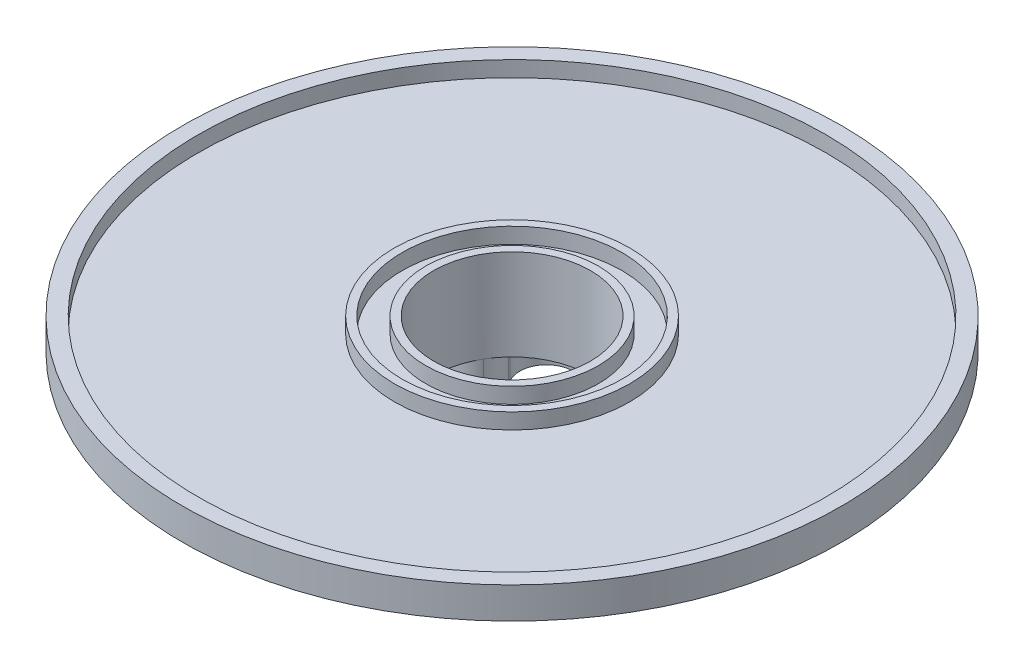
from build123d import *
from build123d.topology import SkipClean

# Parameters (mm, degrees)
CUT_EXTRUDE1_DEPTH  = 11
FILLET1_R           = 8
SKETCH3_R           = 3
CUT_EXTRUDE2_DEPTH  = 3
SKETCH4_R           = 5
CUT_EXTRUDE3_DEPTH  = 4.5
SKETCH5_R           = 25
CUT_EXTRUDE4_DEPTH  = 152.297719745
SKETCH6_R           = 37.5
SKETCH6_R_2         = 35
SKETCH6_R_3         = 27.5
SKETCH6_R_4         = 25
BOSS_EXTRUDE1_DEPTH = 5
CUT_EXTRUDE5_START  = -30
CUT_EXTRUDE5_DEPTH  = 30


# Read off the part's stored shape, not the designer's step: Cut-Extrude5
with BuildPart() as part:
    # Sketch1 → Revolve1 (revolve)
    with BuildSketch(Plane.XY, mode=Mode.PRIVATE) as revolve1_sk:
        Polygon((0, 0), (-50, 0), (-50, 30), (-105, 30), (-105, 40), (-100, 40), (-100, 35), (0, 35), align=None)
    revolve(revolve1_sk.sketch.rotate(Axis((0, 0, 0), (0, 1, 0)), 270), axis=Axis((0, 0, 0), (0, 1, 0)))

    # Sketch2 → Cut-Extrude1 (cut)
    with BuildSketch(Plane.XZ):
        with BuildLine():
            Line((-22.361215932, 21.730762114), (-19.116533878, 16.110807941))
            ThreePointArc((-19.116533878, 16.110807941), (-21.650635095, 12.5), (-23.510635891, 8.5))
            Line((-23.510635891, 8.5), (-30, 8.5))
            ThreePointArc((-30, 8.5), (-38.5, 0), (-30, -8.5))
            Line((-30, -8.5), (-23.510635891, -8.5))
            ThreePointArc((-23.510635891, -8.5), (-21.650635095, -12.5), (-19.116533878, -16.110807941))
            Line((-19.116533878, -16.110807941), (-22.361215932, -21.730762114))
            ThreePointArc((-22.361215932, -21.730762114), (-19.25, -33.341978046), (-7.638784068, -30.230762114))
            Line((-7.638784068, -30.230762114), (-4.394102013, -24.610807941))
            ThreePointArc((-4.394102013, -24.610807941), (0, -25), (4.394102013, -24.610807941))
            Line((4.394102013, -24.610807941), (7.638784068, -30.230762114))
            ThreePointArc((7.638784068, -30.230762114), (19.25, -33.341978046), (22.361215932, -21.730762114))
            Line((22.361215932, -21.730762114), (19.116533878, -16.110807941))
            ThreePointArc((19.116533878, -16.110807941), (21.650635095, -12.5), (23.510635891, -8.5))
            Line((23.510635891, -8.5), (30, -8.5))
            ThreePointArc((30, -8.5), (38.5, 0), (30, 8.5))
            Line((30, 8.5), (23.510635891, 8.5))
            ThreePointArc((23.510635891, 8.5), (21.650635095, 12.5), (19.116533878, 16.110807941))
            Line((19.116533878, 16.110807941), (22.361215932, 21.730762114))
            ThreePointArc((22.361215932, 21.730762114), (19.25, 33.341978046), (7.638784068, 30.230762114))
            Line((7.638784068, 30.230762114), (4.394102013, 24.610807941))
            ThreePointArc((4.394102013, 24.610807941), (0, 25), (-4.394102013, 24.610807941))
            Line((-4.394102013, 24.610807941), (-7.638784068, 30.230762114))
            ThreePointArc((-7.638784068, 30.230762114), (-19.25, 33.341978046), (-22.361215932, 21.730762114))
        make_face()
    extrude(amount=-CUT_EXTRUDE1_DEPTH, mode=Mode.SUBTRACT)

    # Fillet1
    fillet1_edges = [part.edges().sort_by_distance(p)[0] for p in [
        (23.510635891, 5.5, -8.5),
        (19.116533878, 5.5, -16.110807941),
        (-4.394102013, 5.5, -24.610807941),
        (4.394102013, 5.5, -24.610807941),
        (-23.510635891, 5.5, -8.5),
        (-19.116533878, 5.5, -16.110807941),
        (19.116533878, 5.5, 16.110807941),
        (23.510635891, 5.5, 8.5),
        (4.394102013, 5.5, 24.610807941),
        (-4.394102013, 5.5, 24.610807941),
        (-23.510635891, 5.5, 8.5),
        (-19.116533878, 5.5, 16.110807941),
    ]]
    fillet(fillet1_edges, radius=FILLET1_R - 0.0001)  # a hair under: the kernel refuses the full size

    # Sketch3 → Cut-Extrude2 (cut)
    with BuildSketch(Plane.XZ.offset(-11)):
        with Locations(Location((-15, 25.980762114, 0), (0, 0, 270))):
            Circle(SKETCH3_R)
        with Locations(Location((15, 25.980762114, 0), (0, 0, 270))):
            Circle(SKETCH3_R)
        with Locations(Location((30, 0, 0), (0, 0, 270))):
            Circle(SKETCH3_R)
        with Locations(Location((15, -25.980762114, 0), (0, 0, 270))):
            Circle(SKETCH3_R)
        with Locations(Location((-15, -25.980762114, 0), (0, 0, 270))):
            Circle(SKETCH3_R)
        with Locations(Location((-30, 0, 0), (0, 0, 270))):
            Circle(SKETCH3_R)
    extrude(amount=-CUT_EXTRUDE2_DEPTH, mode=Mode.SUBTRACT)

    # Sketch4 → Cut-Extrude3 (cut)
    with BuildSketch(Plane.XZ):
        with Locations(Location((-34.641016151, -20, 0), (0, 0, 270))):
            Circle(SKETCH4_R)
        with Locations(Location((-34.641016151, 20, 0), (0, 0, 270))):
            Circle(SKETCH4_R)
        with Locations(Location((0, 40, 0), (0, 0, 270))):
            Circle(SKETCH4_R)
        with Locations(Location((34.641016151, 20, 0), (0, 0, 270))):
            Circle(SKETCH4_R)
        with Locations(Location((34.641016151, -20, 0), (0, 0, 270))):
            Circle(SKETCH4_R)
        with Locations(Location((0, -40, 0), (0, 0, 270))):
            Circle(SKETCH4_R)
    extrude(amount=-CUT_EXTRUDE3_DEPTH, mode=Mode.SUBTRACT)

    # Sketch5 → Cut-Extrude4 (cut, through all)
    with BuildSketch(Plane.XZ.offset(-11)):
        with Locations(Location((0, 0, 0), (0, 0, 270))):
            Circle(SKETCH5_R)
    extrude(amount=-CUT_EXTRUDE4_DEPTH, mode=Mode.SUBTRACT)

    # Sketch6 → Boss-Extrude1 (add)
    # profile 1 of 2: a face of its own
    with SkipClean():  # the faces are left unmerged after this step: merging them gives an invalid solid
        with BuildSketch(Plane(origin=(0, 35, 0), x_dir=(1, 0, 0), z_dir=(0, 1, 0))):
            with Locations(Location((0, 0, 0), (0, 0, 90))):
                Circle(SKETCH6_R)
            with Locations(Location((0, 0, 0), (0, 0, 270))):
                Circle(SKETCH6_R_2, mode=Mode.SUBTRACT)
        # profile 2 of 2: a face of its own
        with BuildSketch(Plane(origin=(0, 35, 0), x_dir=(1, 0, 0), z_dir=(0, 1, 0))):
            with Locations(Location((0, 0, 0), (0, 0, 90))):
                Circle(SKETCH6_R_3)
            with Locations(Location((0, 0, 0), (0, 0, 270))):
                Circle(SKETCH6_R_4, mode=Mode.SUBTRACT)
        extrude(amount=BOSS_EXTRUDE1_DEPTH)
    add(part.part.scale(1), mode=Mode.REPLACE)  # the faces are merged on a copy

    # Cut-Extrude5 outline → Cut-Extrude5 (cut)
    with BuildSketch(Plane.XZ.offset(CUT_EXTRUDE5_START)):
        with BuildLine():
            Line((7.5, 23.848480035), (7.5, 49.434299833))
            ThreePointArc((7.5, 49.434299833), (0, 50), (-7.5, 49.434299833))
            Line((-7.5, 49.434299833), (-7.5, 23.848480035))
            ThreePointArc((-7.5, 23.848480035), (0, 25), (7.5, 23.848480035))
        make_face()
    extrude(amount=CUT_EXTRUDE5_DEPTH, mode=Mode.SUBTRACT)


solid = part.part
